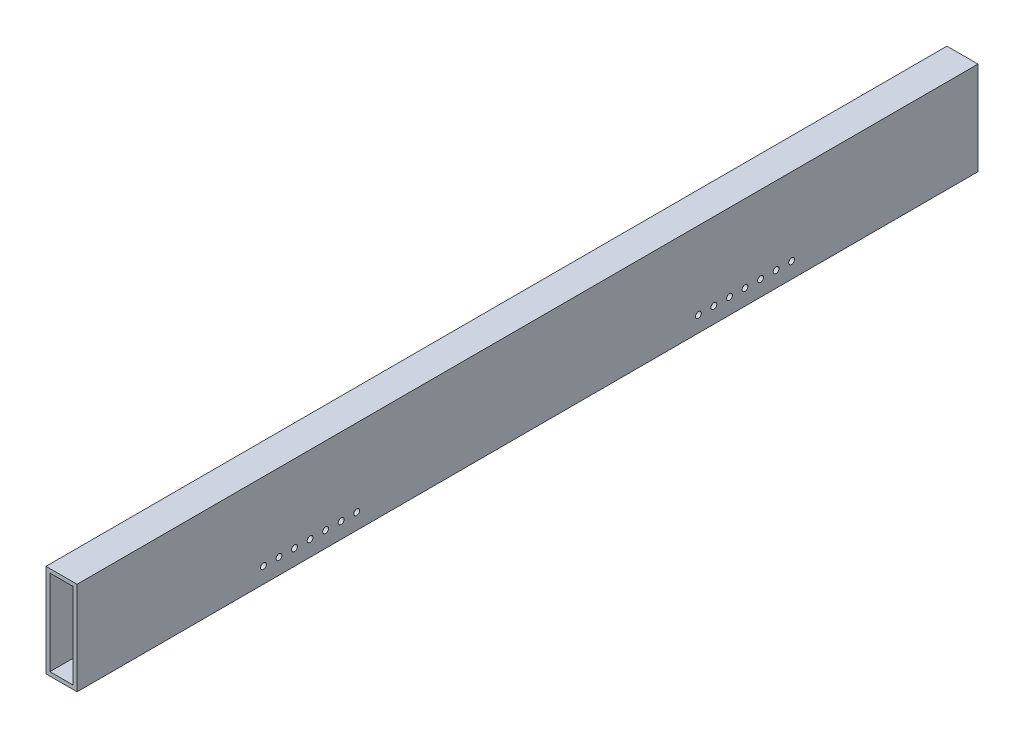
from build123d import *

# Parameters (mm, degrees)
SKETCH1_W           = 25.4
SKETCH1_H           = 76.2
BOSS_EXTRUDE1_DEPTH = 368.3
SHELL1_T            = -3.175
CUT_EXTRUDE2_REACH  = 373.136
SKETCH3_R           = 2.38125


with BuildPart() as part:
    # Sketch1 → Boss-Extrude1 (new, symmetric)
    with BuildSketch(Plane.XY):
        Rectangle(SKETCH1_W, SKETCH1_H)
    extrude(amount=BOSS_EXTRUDE1_DEPTH, both=True)

    # Shell1
    shell1_openings = [part.faces().sort_by_distance(p)[0] for p in [
        (0, 0, -368.3),
        (0, 0, 368.3),
    ]]
    offset(amount=SHELL1_T, openings=shell1_openings, kind=Kind.INTERSECTION)

    # Sketch3 → Cut-Extrude2 (cut, up to next)
    with BuildSketch(Plane(origin=(12.7, 0, 0), x_dir=(0, 0, -1), z_dir=(1, 0, 0)), mode=Mode.PRIVATE) as cut_extrude2_sk1:
        with Locations((215.9, -25.195900078)):
            Circle(SKETCH3_R)
    cut_extrude2_tool1 = extrude(cut_extrude2_sk1.sketch, amount=-CUT_EXTRUDE2_REACH, mode=Mode.PRIVATE) & part.part
    # Sketch3 → Cut-Extrude2 (cut, up to next)
    with BuildSketch(Plane(origin=(12.7, 0, 0), x_dir=(0, 0, -1), z_dir=(1, 0, 0)), mode=Mode.PRIVATE) as cut_extrude2_sk2:
        with Locations((203.2, -25.195900078)):
            Circle(SKETCH3_R)
    cut_extrude2_tool2 = extrude(cut_extrude2_sk2.sketch, amount=-CUT_EXTRUDE2_REACH, mode=Mode.PRIVATE) & part.part
    # Sketch3 → Cut-Extrude2 (cut, up to next)
    with BuildSketch(Plane(origin=(12.7, 0, 0), x_dir=(0, 0, -1), z_dir=(1, 0, 0)), mode=Mode.PRIVATE) as cut_extrude2_sk3:
        with Locations((190.5, -25.195900078)):
            Circle(SKETCH3_R)
    cut_extrude2_tool3 = extrude(cut_extrude2_sk3.sketch, amount=-CUT_EXTRUDE2_REACH, mode=Mode.PRIVATE) & part.part
    # Sketch3 → Cut-Extrude2 (cut, up to next)
    with BuildSketch(Plane(origin=(12.7, 0, 0), x_dir=(0, 0, -1), z_dir=(1, 0, 0)), mode=Mode.PRIVATE) as cut_extrude2_sk4:
        with Locations((177.8, -25.195900078)):
            Circle(SKETCH3_R)
    cut_extrude2_tool4 = extrude(cut_extrude2_sk4.sketch, amount=-CUT_EXTRUDE2_REACH, mode=Mode.PRIVATE) & part.part
    # Sketch3 → Cut-Extrude2 (cut, up to next)
    with BuildSketch(Plane(origin=(12.7, 0, 0), x_dir=(0, 0, -1), z_dir=(1, 0, 0)), mode=Mode.PRIVATE) as cut_extrude2_sk5:
        with Locations((165.1, -25.195900078)):
            Circle(SKETCH3_R)
    cut_extrude2_tool5 = extrude(cut_extrude2_sk5.sketch, amount=-CUT_EXTRUDE2_REACH, mode=Mode.PRIVATE) & part.part
    # Sketch3 → Cut-Extrude2 (cut, up to next)
    with BuildSketch(Plane(origin=(12.7, 0, 0), x_dir=(0, 0, -1), z_dir=(1, 0, 0)), mode=Mode.PRIVATE) as cut_extrude2_sk6:
        with Locations((152.4, -25.195900078)):
            Circle(SKETCH3_R)
    cut_extrude2_tool6 = extrude(cut_extrude2_sk6.sketch, amount=-CUT_EXTRUDE2_REACH, mode=Mode.PRIVATE) & part.part
    # Sketch3 → Cut-Extrude2 (cut, up to next)
    with BuildSketch(Plane(origin=(12.7, 0, 0), x_dir=(0, 0, -1), z_dir=(1, 0, 0)), mode=Mode.PRIVATE) as cut_extrude2_sk7:
        with Locations((139.7, -25.195900078)):
            Circle(SKETCH3_R)
    cut_extrude2_tool7 = extrude(cut_extrude2_sk7.sketch, amount=-CUT_EXTRUDE2_REACH, mode=Mode.PRIVATE) & part.part
    # Sketch3 → Cut-Extrude2 (cut, up to next)
    with BuildSketch(Plane(origin=(12.7, 0, 0), x_dir=(0, 0, -1), z_dir=(1, 0, 0)), mode=Mode.PRIVATE) as cut_extrude2_sk8:
        with Locations((-139.7, -25.195900078)):
            Circle(SKETCH3_R)
    cut_extrude2_tool8 = extrude(cut_extrude2_sk8.sketch, amount=-CUT_EXTRUDE2_REACH, mode=Mode.PRIVATE) & part.part
    # Sketch3 → Cut-Extrude2 (cut, up to next)
    with BuildSketch(Plane(origin=(12.7, 0, 0), x_dir=(0, 0, -1), z_dir=(1, 0, 0)), mode=Mode.PRIVATE) as cut_extrude2_sk9:
        with Locations((-152.4, -25.195900078)):
            Circle(SKETCH3_R)
    cut_extrude2_tool9 = extrude(cut_extrude2_sk9.sketch, amount=-CUT_EXTRUDE2_REACH, mode=Mode.PRIVATE) & part.part
    # Sketch3 → Cut-Extrude2 (cut, up to next)
    with BuildSketch(Plane(origin=(12.7, 0, 0), x_dir=(0, 0, -1), z_dir=(1, 0, 0)), mode=Mode.PRIVATE) as cut_extrude2_sk10:
        with Locations((-165.1, -25.195900078)):
            Circle(SKETCH3_R)
    cut_extrude2_tool10 = extrude(cut_extrude2_sk10.sketch, amount=-CUT_EXTRUDE2_REACH, mode=Mode.PRIVATE) & part.part
    # Sketch3 → Cut-Extrude2 (cut, up to next)
    with BuildSketch(Plane(origin=(12.7, 0, 0), x_dir=(0, 0, -1), z_dir=(1, 0, 0)), mode=Mode.PRIVATE) as cut_extrude2_sk11:
        with Locations((-203.2, -25.195900078)):
            Circle(SKETCH3_R)
    cut_extrude2_tool11 = extrude(cut_extrude2_sk11.sketch, amount=-CUT_EXTRUDE2_REACH, mode=Mode.PRIVATE) & part.part
    # Sketch3 → Cut-Extrude2 (cut, up to next)
    with BuildSketch(Plane(origin=(12.7, 0, 0), x_dir=(0, 0, -1), z_dir=(1, 0, 0)), mode=Mode.PRIVATE) as cut_extrude2_sk12:
        with Locations((-177.8, -25.195900078)):
            Circle(SKETCH3_R)
    cut_extrude2_tool12 = extrude(cut_extrude2_sk12.sketch, amount=-CUT_EXTRUDE2_REACH, mode=Mode.PRIVATE) & part.part
    # Sketch3 → Cut-Extrude2 (cut, up to next)
    with BuildSketch(Plane(origin=(12.7, 0, 0), x_dir=(0, 0, -1), z_dir=(1, 0, 0)), mode=Mode.PRIVATE) as cut_extrude2_sk13:
        with Locations((-215.9, -25.195900078)):
            Circle(SKETCH3_R)
    cut_extrude2_tool13 = extrude(cut_extrude2_sk13.sketch, amount=-CUT_EXTRUDE2_REACH, mode=Mode.PRIVATE) & part.part
    # Sketch3 → Cut-Extrude2 (cut, up to next)
    with BuildSketch(Plane(origin=(12.7, 0, 0), x_dir=(0, 0, -1), z_dir=(1, 0, 0)), mode=Mode.PRIVATE) as cut_extrude2_sk14:
        with Locations((-190.5, -25.195900078)):
            Circle(SKETCH3_R)
    cut_extrude2_tool14 = extrude(cut_extrude2_sk14.sketch, amount=-CUT_EXTRUDE2_REACH, mode=Mode.PRIVATE) & part.part
    add(cut_extrude2_tool1.solids().sort_by_distance((12.7, -25.1959, -215.9))[0], mode=Mode.SUBTRACT)
    add(cut_extrude2_tool2.solids().sort_by_distance((12.7, -25.1959, -203.2))[0], mode=Mode.SUBTRACT)
    add(cut_extrude2_tool3.solids().sort_by_distance((12.7, -25.1959, -190.5))[0], mode=Mode.SUBTRACT)
    add(cut_extrude2_tool4.solids().sort_by_distance((12.7, -25.1959, -177.8))[0], mode=Mode.SUBTRACT)
    add(cut_extrude2_tool5.solids().sort_by_distance((12.7, -25.1959, -165.1))[0], mode=Mode.SUBTRACT)
    add(cut_extrude2_tool6.solids().sort_by_distance((12.7, -25.1959, -152.4))[0], mode=Mode.SUBTRACT)
    add(cut_extrude2_tool7.solids().sort_by_distance((12.7, -25.1959, -139.7))[0], mode=Mode.SUBTRACT)
    add(cut_extrude2_tool8.solids().sort_by_distance((12.7, -25.1959, 139.7))[0], mode=Mode.SUBTRACT)
    add(cut_extrude2_tool9.solids().sort_by_distance((12.7, -25.1959, 152.4))[0], mode=Mode.SUBTRACT)
    add(cut_extrude2_tool10.solids().sort_by_distance((12.7, -25.1959, 165.1))[0], mode=Mode.SUBTRACT)
    add(cut_extrude2_tool11.solids().sort_by_distance((12.7, -25.1959, 203.2))[0], mode=Mode.SUBTRACT)
    add(cut_extrude2_tool12.solids().sort_by_distance((12.7, -25.1959, 177.8))[0], mode=Mode.SUBTRACT)
    add(cut_extrude2_tool13.solids().sort_by_distance((12.7, -25.1959, 215.9))[0], mode=Mode.SUBTRACT)
    add(cut_extrude2_tool14.solids().sort_by_distance((12.7, -25.1959, 190.5))[0], mode=Mode.SUBTRACT)


solid = part.part
